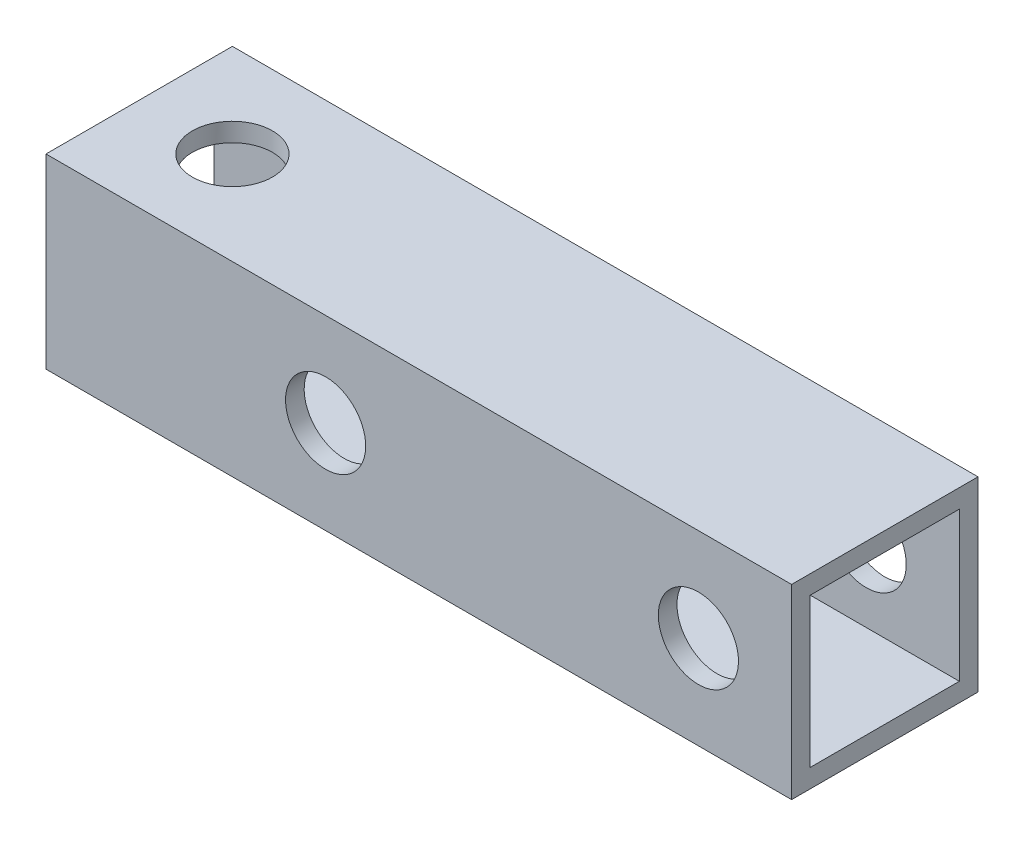
from build123d import *

# Parameters (mm, degrees)
SKETCH_1_W               = 10
SKETCH_1_H               = 10
SKETCH_1_W_2             = 8
SKETCH_1_H_2             = 8
EXTRUDE_1_DEPTH          = 40
CUT_EXTRUDE_1_DEPTH      = 42.533119315
CUT_EXTRUDE_1_DEPTH_BACK = 42.533119315
SKETCH_2_R               = 2.15
SKETCH_3_R               = 2.15
CUT_EXTRUDE_2_DEPTH      = 42.533119315


with BuildPart() as part:
    # ｽｹｯﾁ1 → 押し出し-薄板1 (new body)
    with BuildSketch(Plane(origin=(0, 0, 0), x_dir=(0, 0, -1), z_dir=(1, 0, 0))):
        Rectangle(SKETCH_1_W, SKETCH_1_H)
        Rectangle(SKETCH_1_W_2, SKETCH_1_H_2, mode=Mode.SUBTRACT)
    extrude(amount=EXTRUDE_1_DEPTH)

    # ｽｹｯﾁ2 → ｶｯﾄ - 押し出し1 (cut, two sides: drawn at the far end of the back side and taken through both)
    with BuildSketch(Plane.XY.offset(5).offset(-CUT_EXTRUDE_1_DEPTH_BACK)):
        with Locations((35, 0)):
            Circle(SKETCH_2_R)
        with Locations((15, 0)):
            Circle(SKETCH_2_R)
    extrude(amount=CUT_EXTRUDE_1_DEPTH + CUT_EXTRUDE_1_DEPTH_BACK, mode=Mode.SUBTRACT)

    # ｽｹｯﾁ3 → ｶｯﾄ - 押し出し2 (cut, through all)
    with BuildSketch(Plane(origin=(0, 5, 0), x_dir=(1, 0, 0), z_dir=(0, 1, 0))):
        with Locations((5, 0)):
            Circle(SKETCH_3_R)
    extrude(amount=-CUT_EXTRUDE_2_DEPTH, mode=Mode.SUBTRACT)


solid = part.part
